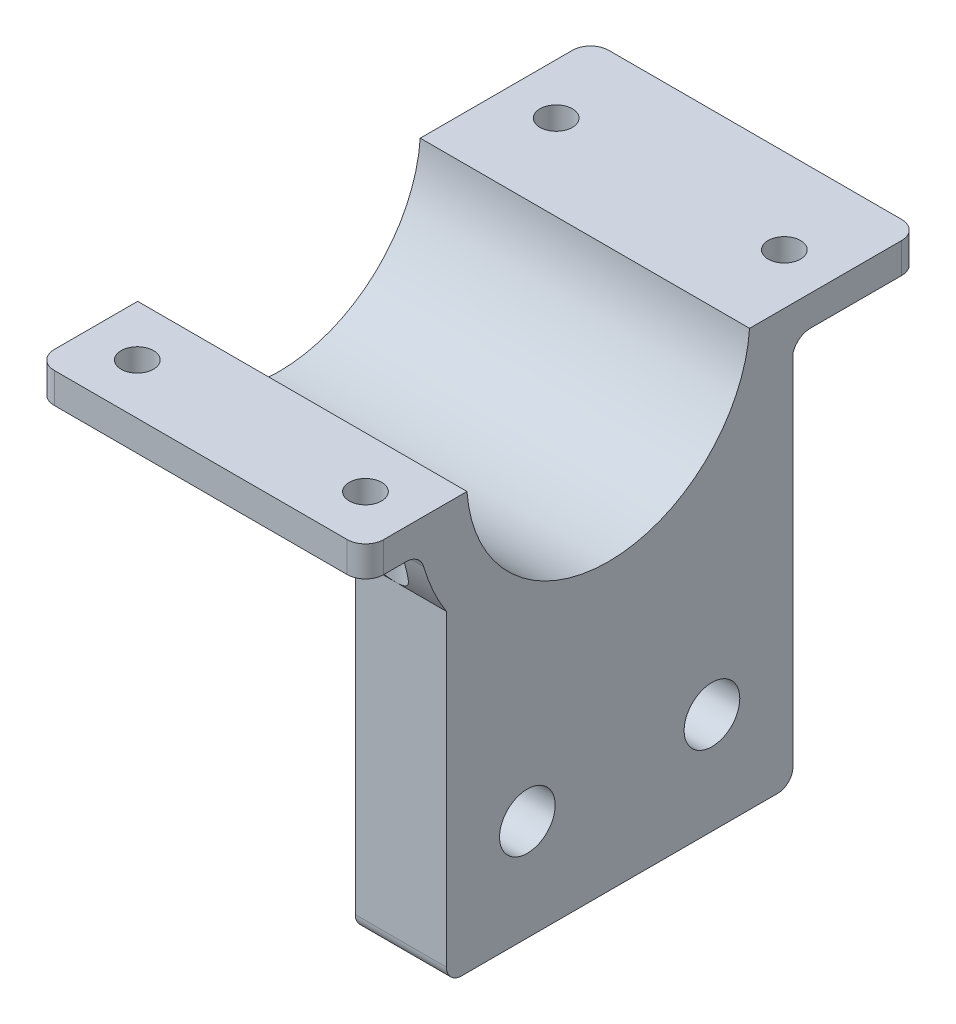
from build123d import *

# Parameters (mm, degrees)
SKETCH1_W                       = 62.15
SKETCH1_H                       = 78
BOSS_EXTRUDE1_DEPTH             = 9
SPRING_PULLEY_CUTOUT_DEPTH      = 10
SPRING_PULLEY_CUTOUT_DEPTH_BACK = 11.2
SKETCH2_R                       = 25
SKETCH3_R                       = 1.225
CUT_EXTRUDE2_DEPTH              = 7.5
SKETCH4_R                       = 0.75
CUT_EXTRUDE3_DEPTH              = 101.014361469
CHAMFER1_SIZE                   = 0.4
CHAMFER1_SIZE2                  = 0.692820323
MOTOR_HOLDER_DEPTH              = 32.95
MOVE_FACE7_BY                   = 0.4
SKETCH20_R                      = 2.55
CUT_EXTRUDE8_DEPTH              = 7
BOSS_EXTRUDE5_DEPTH             = 32.55
MOVE_FACE3_BY                   = 1
CUT_EXTRUDE12_DEPTH             = 108.086985671
FILLET12_R                      = 1.8
SKETCH24_R                      = 1.6
MOTOR_CLIP_HOLES_DEPTH          = 3
SKETCH26_W                      = 5.75
SKETCH26_H                      = 12.7
CUT_EXTRUDE13_DEPTH             = 110.829970864
SKETCH27_R                      = 2
CUT_EXTRUDE14_DEPTH             = 7.25
SKETCH29_R                      = 0.8
CUT_EXTRUDE16_DEPTH             = 5
SKETCH52_W                      = 78
SKETCH52_H                      = 9
CUT_EXTRUDE31_DEPTH             = 7.25
MOVE_START                      = -54.4
MOVE_FACE6_OUTLINE_W            = 5.75
MOVE_FACE6_OUTLINE_H            = 9
MOVE_FACE6_DEPTH                = 13.1
SKETCH31_W                      = 2
SKETCH31_H                      = 4
SKETCH32_R                      = 3
CUT_EXTRUDE17_DEPTH             = 105.439563953
MOTOR_CLIP_WIRE_FILLET_R        = 2
BOSS_EXTRUDE8_DEPTH             = 9
FILLET13_R                      = 1.5
M5_CLEARANCE_HOLE1_D            = 5.5


# Read off the part's stored shape, not the designer's step: Move Face6
with BuildPart() as part:
    # Sketch1 → Boss-Extrude1 (new body)
    with BuildSketch(Plane(origin=(0, 0, 0), x_dir=(1, 0, 0), z_dir=(0, 1, 0))):
        with Locations((31.075, 39)):
            Rectangle(SKETCH1_W, SKETCH1_H)
    extrude(amount=BOSS_EXTRUDE1_DEPTH)

    # Sketch2 → spring_pulley_cutout (cut, two sides: drawn at the far end of the back side and taken through both)
    with BuildSketch(Plane.ZY.offset(-18).offset(-SPRING_PULLEY_CUTOUT_DEPTH_BACK)):
        with Locations((-24, -18)):
            Circle(SKETCH2_R)
    extrude(amount=SPRING_PULLEY_CUTOUT_DEPTH + SPRING_PULLEY_CUTOUT_DEPTH_BACK, mode=Mode.SUBTRACT)

    # Sketch3 → Cut-Extrude2 (cut)
    with BuildSketch(Plane(origin=(0, 9, 0), x_dir=(1, 0, 0), z_dir=(0, 1, 0))):
        with Locations(Location((12.85, 4, 0), (0, 0, 270))):
            Circle(SKETCH3_R)
        with Locations(Location((23.15, 44, 0), (0, 0, 270))):
            Circle(SKETCH3_R)
    extrude(amount=-CUT_EXTRUDE2_DEPTH, mode=Mode.SUBTRACT)

    # Sketch4 → Cut-Extrude3 (cut, through all)
    with BuildSketch(Plane(origin=(0, 1.5, 0), x_dir=(1, 0, 0), z_dir=(0, 1, 0))):
        with Locations(Location((12.85, 4, 0), (0, 0, 270))):
            Circle(SKETCH4_R)
        with Locations(Location((23.15, 44, 0), (0, 0, 270))):
            Circle(SKETCH4_R)
    extrude(amount=-CUT_EXTRUDE3_DEPTH, mode=Mode.SUBTRACT)

    # Chamfer1
    chamfer1_edges = [part.edges().sort_by_distance(p)[0] for p in [
        (12.85, 9, -5.225),
        (23.15, 9, -45.225),
    ]]
    chamfer1_side = [part.faces().sort_by_distance(p)[0] for p in [
        (31.100480241, 9, -39.029231634),
    ]]
    chamfer(chamfer1_edges, length=CHAMFER1_SIZE, length2=CHAMFER1_SIZE2, reference=chamfer1_side[0])

    # Sketch19 → Motor Holder (add)
    with BuildSketch(Plane.ZY.offset(-29.2)):
        with BuildLine():
            Line((-54.8, -18), (-38, -18))
            ThreePointArc((-38, -18), (-24, -4), (-10, -18))
            Line((-10, -18), (0, -18))
            Line((0, -18), (0, 0))
            Line((0, 0), (-54.8, 0))
            Line((-54.8, 0), (-54.8, -18))
        make_face()
    extrude(amount=-MOTOR_HOLDER_DEPTH)

    # Move Face7: a face moved inward by 0.4
    extrude(part.faces().sort_by_distance((29.2, 0.75, -27.4))[0], amount=MOVE_FACE7_BY, dir=(1, 0, 0), mode=Mode.SUBTRACT)

    # Sketch20 → Cut-Extrude8 (cut)
    with BuildSketch(Plane(origin=(0, -18, 0), x_dir=(-1, 0, 0), z_dir=(0, -1, 0))):
        with Locations(Location((-57.15, 5, 0), (0, 0, 90))):
            Circle(SKETCH20_R)
        with Locations(Location((-34.6, 5, 0), (0, 0, 90))):
            Circle(SKETCH20_R)
        with Locations(Location((-57.15, 46.4, 0), (0, 0, 90))):
            Circle(SKETCH20_R)
        with Locations(Location((-34.6, 46.4, 0), (0, 0, 90))):
            Circle(SKETCH20_R)
    extrude(amount=-CUT_EXTRUDE8_DEPTH, mode=Mode.SUBTRACT)

    # Move Face3: a face moved inward by 1.0
    extrude(part.faces().sort_by_distance((8, 2.836578696, -24))[0], amount=MOVE_FACE3_BY, dir=(-1, 0, 0), mode=Mode.SUBTRACT)

    # Sketch26 → Cut-Extrude13 (cut, through all)
    with BuildSketch(Plane(origin=(0, 9, 0), x_dir=(1, 0, 0), z_dir=(0, 1, 0))):
        with Locations((10.125, 47.85)):
            Rectangle(SKETCH26_W, SKETCH26_H)
    extrude(amount=-CUT_EXTRUDE13_DEPTH, mode=Mode.SUBTRACT)

    # Sketch27 → Cut-Extrude14 (cut)
    with BuildSketch(Plane.ZY):
        with Locations((-44.6, 5)):
            Circle(SKETCH27_R)
        with Locations((-51.1, 5)):
            Circle(SKETCH27_R)
    extrude(amount=-CUT_EXTRUDE14_DEPTH, mode=Mode.SUBTRACT)

    # Sketch29 → Cut-Extrude16 (cut)
    with BuildSketch(Plane.ZY.offset(-13)):
        with Locations((-51.1, 5)):
            Circle(SKETCH29_R)
        with Locations((-44.6, 5)):
            Circle(SKETCH29_R)
    extrude(amount=-CUT_EXTRUDE16_DEPTH, mode=Mode.SUBTRACT)

    # Sketch52 → Cut-Extrude31 (cut)
    with BuildSketch(Plane.ZY):
        with Locations((-39, 4.5)):
            Rectangle(SKETCH52_W, SKETCH52_H)
    extrude(amount=-CUT_EXTRUDE31_DEPTH, mode=Mode.SUBTRACT)

    # Move Face6 outline → Move Face6 (cut)
    with BuildSketch(Plane.XY.offset(MOVE_START)):
        with Locations((10.125, 4.5)):
            Rectangle(MOVE_FACE6_OUTLINE_W, MOVE_FACE6_OUTLINE_H)
    extrude(amount=MOVE_FACE6_DEPTH, mode=Mode.SUBTRACT)

    # Cut-Sweep1: sweep along a path in Sketch30
    with BuildLine(Plane(origin=(0, -12, 0), x_dir=(-1, 0, 0), z_dir=(0, -1, 0))) as cut_sweep1_path:
        CenterArc((-45.875, 0), 5, 0, 360)
    # Sketch31 → Cut-Sweep1 (sweep, cut)
    with BuildSketch(Plane(origin=(0, 0, 0), x_dir=(-1, 0, 0), z_dir=(0, 0, -1))):
        with Locations((-42.875, -12)):
            Rectangle(SKETCH31_W, SKETCH31_H)
    sweep(path=cut_sweep1_path.line, mode=Mode.SUBTRACT)


with BuildPart() as body_2:
    # Sketch22 → Boss-Extrude5 (new body)
    with BuildSketch(Plane.ZY.offset(-29.6)):
        with BuildLine():
            Line((0, -19), (-10.035759956, -19))
            ThreePointArc((-10.035759956, -19), (-24, -32), (-37.964240044, -19))
            Line((-37.964240044, -19), (-54.8, -19))
            Line((-54.8, -19), (-54.8, -39))
            Line((-54.8, -39), (0, -39))
            Line((0, -39), (0, -19))
        make_face()
    extrude(amount=-BOSS_EXTRUDE5_DEPTH)

    # Sketch25 → Cut-Extrude12 (cut, through all)
    with BuildSketch(Plane(origin=(62.15, 0, 0), x_dir=(0, 0, -1), z_dir=(1, 0, 0))):
        with BuildLine():
            Line((54.8, -22), (42.574175621, -22))
            ThreePointArc((42.574175621, -22), (24, -37), (5.425824379, -22))
            Line((5.425824379, -22), (0, -22))
            Line((0, -22), (0, -42))
            Line((0, -42), (54.8, -42))
            Line((54.8, -42), (54.8, -22))
        make_face()
    extrude(amount=-CUT_EXTRUDE12_DEPTH, mode=Mode.SUBTRACT)

    # Fillet12
    fillet12_edges = [body_2.edges().sort_by_distance(p)[0] for p in [
        (62.15, -20.5, 0),
        (62.15, -20.5, -54.8),
        (29.6, -20.5, 0),
        (45.875, -22, -5.425824379),
        (45.875, -22, -42.574175621),
        (29.6, -20.5, -54.8),
    ]]
    fillet(fillet12_edges, radius=FILLET12_R)

    # Sketch24 → Motor Clip Holes (cut)
    with BuildSketch(Plane.XZ.offset(22)):
        with Locations(Location((34.6, -5, 0), (0, 0, 37.543618534))):
            Circle(SKETCH24_R)
        with Locations(Location((57.15, -5, 0), (0, 0, 37.543618534))):
            Circle(SKETCH24_R)
        with Locations(Location((34.6, -46.4, 0), (0, 0, 270))):
            Circle(SKETCH24_R)
        with Locations(Location((57.15, -46.4, 0), (0, 0, 270))):
            Circle(SKETCH24_R)
    extrude(amount=-MOTOR_CLIP_HOLES_DEPTH, mode=Mode.SUBTRACT)

    # Sketch32 → Cut-Extrude17 (cut, through all)
    with BuildSketch(Plane.XZ.offset(22)):
        with Locations((57.15, -5)):
            Circle(SKETCH32_R)
        with Locations((57.15, -46.4)):
            Circle(SKETCH32_R)
        with Locations((34.6, -46.4)):
            Circle(SKETCH32_R)
        with Locations((34.6, -5)):
            Circle(SKETCH32_R)
    extrude(amount=CUT_EXTRUDE17_DEPTH, mode=Mode.SUBTRACT)

    # Motor Clip Wire Fillet
    # the kernel refuses this fillet: 2 mm, written as the material it takes off along each edge
    with BuildSketch(Plane(origin=(29.6, -18, -24), x_dir=(0, -0.27884615384615374, 0.9603357863191433), z_dir=(0, 0.9603357863191433, 0.27884615384615374))) as motor_clip_wire_fillet_piece_1:
        with BuildLine():
            CenterArc((19 - MOTOR_CLIP_WIRE_FILLET_R, MOTOR_CLIP_WIRE_FILLET_R), MOTOR_CLIP_WIRE_FILLET_R, 270, 90)
            Line((19 - MOTOR_CLIP_WIRE_FILLET_R, 0), (19, 0))
            Line((19, 0), (19, MOTOR_CLIP_WIRE_FILLET_R))
        make_face()
    revolve(axis=Axis((29.6, -18, -24), (1, 0, 0)), revolution_arc=147.617296723, mode=Mode.SUBTRACT)
    with BuildSketch(Plane(origin=(29.6, -23.8, -43.974984355), x_dir=(0, 0.2788461538461544, 0.960335786319143), z_dir=(0, -0.960335786319143, 0.2788461538461544))) as motor_clip_wire_fillet_piece_2:
        with BuildLine():
            CenterArc((1.8 + MOTOR_CLIP_WIRE_FILLET_R, -MOTOR_CLIP_WIRE_FILLET_R), MOTOR_CLIP_WIRE_FILLET_R, 90, 90)
            Line((1.8 + MOTOR_CLIP_WIRE_FILLET_R, 0), (1.8, 0))
            Line((1.8, 0), (1.8, -MOTOR_CLIP_WIRE_FILLET_R))
        make_face()
    revolve(axis=Axis((29.6, -23.8, -43.974984355), (-1, 0, 0)), revolution_arc=233.006586684, mode=Mode.SUBTRACT)
    with BuildSketch(Plane(origin=(29.6, -23.8, -4.025015645), x_dir=(0, -0.9348128979547861, 0.3551406000690075), z_dir=(0, -0.3551406000690075, -0.9348128979547861))) as motor_clip_wire_fillet_piece_3:
        with BuildLine():
            CenterArc((1.8 + MOTOR_CLIP_WIRE_FILLET_R, -MOTOR_CLIP_WIRE_FILLET_R), MOTOR_CLIP_WIRE_FILLET_R, 90, 90)
            Line((1.8 + MOTOR_CLIP_WIRE_FILLET_R, 0), (1.8, 0))
            Line((1.8, 0), (1.8, -MOTOR_CLIP_WIRE_FILLET_R))
        make_face()
    revolve(axis=Axis((29.6, -23.8, -4.025015645), (-1, 0, 0)), revolution_arc=233.006586684, mode=Mode.SUBTRACT)

    # Sketch64 → Boss-Extrude8 (add)
    with BuildSketch(Plane(origin=(62.15, 0, 0), x_dir=(0, 0, -1), z_dir=(1, 0, 0))):
        with BuildLine():
            Line((8, -28.246950766), (8, -60.2))
            Line((8, -60.2), (42.24637994, -60.2))
            Line((42.24637994, -60.2), (42.24637994, -23.298076923))
            ThreePointArc((42.24637994, -23.298076923), (26.717424109, -36.804669798), (8, -28.246950766))
        make_face()
    extrude(amount=-BOSS_EXTRUDE8_DEPTH)

    # Fillet13
    fillet13_edges = [body_2.edges().sort_by_distance(p)[0] for p in [
        (57.65, -60.2, -42.24637994),
        (57.65, -60.2, -8),
    ]]
    fillet(fillet13_edges, radius=FILLET13_R)

    # M5 Clearance Hole1 (through all)
    with Locations(Plane(origin=(62.15, 0, 0), x_dir=(0, 0, -1), z_dir=(1, 0, 0))):
        with Locations((16, -50.2), (34.24637994, -50.2)):
            Hole(M5_CLEARANCE_HOLE1_D / 2)


solid = body_2.part
